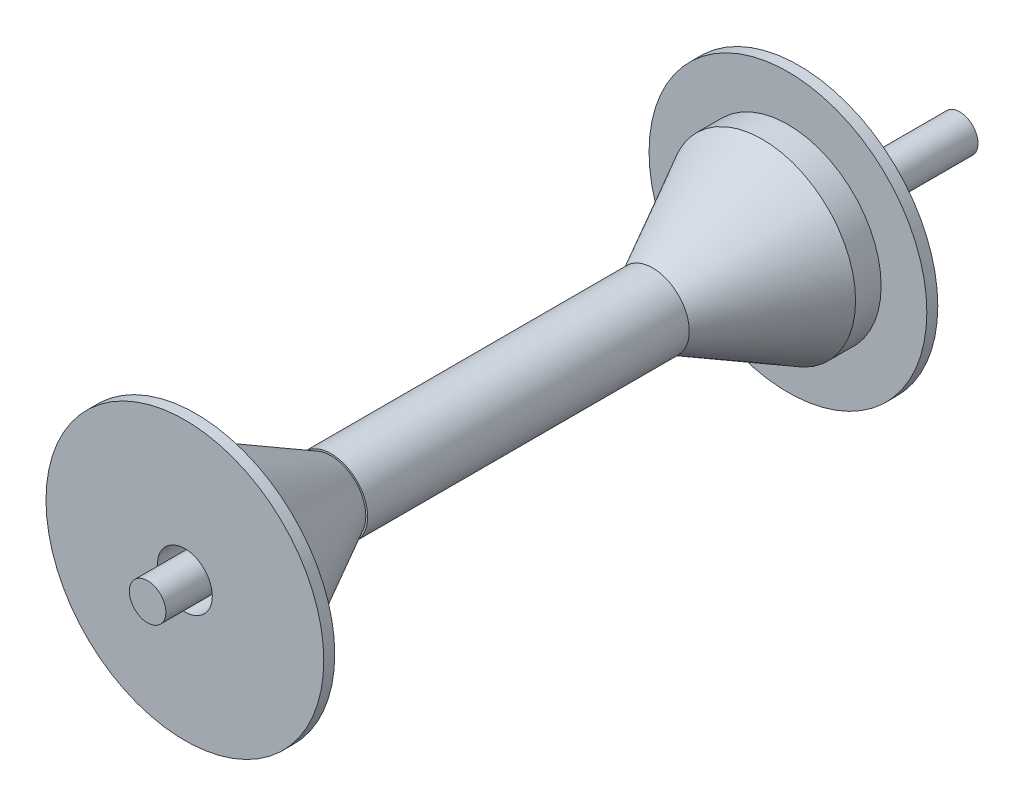
from build123d import *

# Parameters (mm, degrees)
SKETCH1_R               = 6.35
BOSS_EXTRUDE1_DEPTH     = 282.194
SKETCH15_W              = 3.81
SKETCH15_H              = 25.4
CUT_EXTRUDE1_DEPTH      = 291.32999989
CUT_EXTRUDE1_DEPTH_BACK = 291.32999989
SKETCH16_R              = 2.54
SKETCH18_W              = 3.175
SKETCH18_H              = 111.76


with BuildPart() as part:
    # Sketch1 → Boss-Extrude1 (new body)
    with BuildSketch(Plane.XY):
        Circle(SKETCH1_R)
    extrude(amount=BOSS_EXTRUDE1_DEPTH)

    # Sketch16 → Cut-Extrude1 (cut, two sides: drawn at the far end of the back side and taken through both)
    with BuildSketch(Plane(origin=(0, 0, 0), x_dir=(1, 0, 0), z_dir=(0, 1, 0)).offset(-CUT_EXTRUDE1_DEPTH_BACK)):
        with Locations((0, -88.9)):
            Circle(SKETCH16_R)
        with Locations((0, -162.56)):
            Circle(SKETCH16_R)
        with Locations((0, -236.22)):
            Circle(SKETCH16_R)
    extrude(amount=CUT_EXTRUDE1_DEPTH + CUT_EXTRUDE1_DEPTH_BACK, mode=Mode.SUBTRACT)


with BuildPart() as body_2:
    # Sketch14 → Revolve1 (revolve)
    with BuildSketch(Plane(origin=(0, 0, 0), x_dir=(0, 0, -1), z_dir=(1, 0, 0))):
        Polygon((-106.68, 9.525), (-55.88, 9.525), (-55.88, 32.385), (-68.58, 32.385), (-106.68, 12.065), align=None)
    revolve(axis=Axis((0, 0, 282.194), (0, 0, -1)))


with BuildPart() as body_3:
    # Sketch15 → Revolve2 (revolve)
    with BuildSketch(Plane(origin=(0, 0, 0), x_dir=(0, 0, -1), z_dir=(1, 0, 0))):
        with Locations((-57.785, 35.56)):
            Rectangle(SKETCH15_W, SKETCH15_H)
    revolve(axis=Axis((0, 0, 282.194), (0, 0, -1)))

    # Combine1: union body 2
    add(body_2.part)


with BuildPart() as body_3_2:
    # Mirror4: mirrored copy
    add(body_3.part.mirror(Plane(origin=(0, 0, 162.56), x_dir=(1, 0, 0), z_dir=(0, 0, -1))))


with BuildPart() as body_3_1:
    add(body_3.part)

    add(body_3_2.part)  # Revolve4 merges body 3 2
    # Sketch18 → Revolve4 (revolve)
    with BuildSketch(Plane(origin=(0, 0, 0), x_dir=(1, 0, 0), z_dir=(0, 1, 0))):
        with Locations((-11.1125, -162.56)):
            Rectangle(SKETCH18_W, SKETCH18_H)
    revolve(axis=Axis((0, 0, 282.194), (0, 0, -1)))


solid = Compound([part.part, body_3_1.part])
